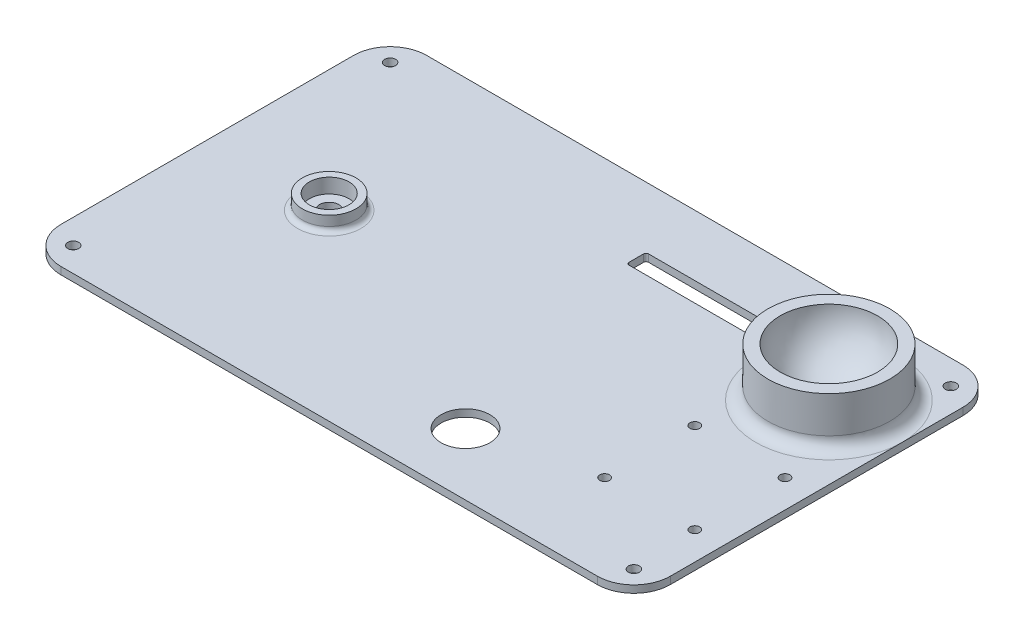
from build123d import *

# Parameters (mm, degrees)
CROQUIS1_W              = 250
CROQUIS1_H              = 150
SALIENTE_EXTRUIR1_DEPTH = 3
REDONDEO1_R             = 15
CORTAR_EXTRUIR1_REACH   = 147.805
CROQUIS2_R              = 2.25
CROQUIS3_R              = 4
CORTAR_EXTRUIR2_DEPTH   = 5
CROQUIS4_R              = 11
CROQUIS4_R_2            = 8.15
SALIENTE_EXTRUIR2_DEPTH = 6
REDONDEO2_R             = 2
CROQUIS5_R              = 25
CROQUIS5_R_2            = 20
SALIENTE_EXTRUIR3_DEPTH = 20
REDONDEO3_R             = 20
REDONDEO4_R             = 5
CROQUIS11_W             = 60
CROQUIS11_H             = 8
CORTAR_EXTRUIR6_DEPTH   = 20
REDONDEO7_R             = 1
CROQUIS12_R             = 10
CORTAR_EXTRUIR7_DEPTH   = 200
CROQUIS6_R              = 2
CORTAR_EXTRUIR8_DEPTH   = 10


with BuildPart() as part:
    # Croquis1 → Saliente-Extruir1 (new body)
    with BuildSketch(Plane(origin=(0, 0, 0), x_dir=(1, 0, 0), z_dir=(0, 1, 0))):
        Rectangle(CROQUIS1_W, CROQUIS1_H)
    extrude(amount=SALIENTE_EXTRUIR1_DEPTH)

    # Redondeo1
    redondeo1_edges = [part.edges().sort_by_distance(p)[0] for p in [
        (125, 1.5, 75),
        (-125, 1.5, 75),
        (-125, 1.5, -75),
        (125, 1.5, -75),
    ]]
    fillet(redondeo1_edges, radius=REDONDEO1_R)

    # Croquis2 → Cortar-Extruir1 (cut, up to next)
    with BuildSketch(Plane(origin=(0, 3, 0), x_dir=(1, 0, 0), z_dir=(0, 1, 0)), mode=Mode.PRIVATE) as cortar_extruir1_sk1:
        with Locations(Location((-115, 65, 0), (0, 0, 270))):
            Circle(CROQUIS2_R)
    cortar_extruir1_tool1 = extrude(cortar_extruir1_sk1.sketch, amount=-CORTAR_EXTRUIR1_REACH, mode=Mode.PRIVATE) & part.part
    # Croquis2 → Cortar-Extruir1 (cut, up to next)
    with BuildSketch(Plane(origin=(0, 3, 0), x_dir=(1, 0, 0), z_dir=(0, 1, 0)), mode=Mode.PRIVATE) as cortar_extruir1_sk2:
        with Locations(Location((115, 65, 0), (0, 0, 270))):
            Circle(CROQUIS2_R)
    cortar_extruir1_tool2 = extrude(cortar_extruir1_sk2.sketch, amount=-CORTAR_EXTRUIR1_REACH, mode=Mode.PRIVATE) & part.part
    # Croquis2 → Cortar-Extruir1 (cut, up to next)
    with BuildSketch(Plane(origin=(0, 3, 0), x_dir=(1, 0, 0), z_dir=(0, 1, 0)), mode=Mode.PRIVATE) as cortar_extruir1_sk3:
        with Locations(Location((115, -65, 0), (0, 0, 270))):
            Circle(CROQUIS2_R)
    cortar_extruir1_tool3 = extrude(cortar_extruir1_sk3.sketch, amount=-CORTAR_EXTRUIR1_REACH, mode=Mode.PRIVATE) & part.part
    # Croquis2 → Cortar-Extruir1 (cut, up to next)
    with BuildSketch(Plane(origin=(0, 3, 0), x_dir=(1, 0, 0), z_dir=(0, 1, 0)), mode=Mode.PRIVATE) as cortar_extruir1_sk4:
        with Locations(Location((-115, -65, 0), (0, 0, 270))):
            Circle(CROQUIS2_R)
    cortar_extruir1_tool4 = extrude(cortar_extruir1_sk4.sketch, amount=-CORTAR_EXTRUIR1_REACH, mode=Mode.PRIVATE) & part.part
    add(cortar_extruir1_tool1.solids().sort_by_distance((-115, 3, -65))[0], mode=Mode.SUBTRACT)
    add(cortar_extruir1_tool2.solids().sort_by_distance((115, 3, -65))[0], mode=Mode.SUBTRACT)
    add(cortar_extruir1_tool3.solids().sort_by_distance((115, 3, 65))[0], mode=Mode.SUBTRACT)
    add(cortar_extruir1_tool4.solids().sort_by_distance((-115, 3, 65))[0], mode=Mode.SUBTRACT)

    # Croquis3 → Cortar-Extruir2 (cut)
    with BuildSketch(Plane(origin=(0, 3, 0), x_dir=(1, 0, 0), z_dir=(0, 1, 0))):
        with Locations(Location((-75, 0, 0), (0, 0, 270))):
            Circle(CROQUIS3_R)
    extrude(amount=-CORTAR_EXTRUIR2_DEPTH, mode=Mode.SUBTRACT)

    # Croquis4 → Saliente-Extruir2 (add)
    with BuildSketch(Plane(origin=(0, 3, 0), x_dir=(1, 0, 0), z_dir=(0, 1, 0))):
        with Locations(Location((-75, 0, 0), (0, 0, 90))):
            Circle(CROQUIS4_R)
        with Locations(Location((-75, 0, 0), (0, 0, 270))):
            Circle(CROQUIS4_R_2, mode=Mode.SUBTRACT)
    extrude(amount=SALIENTE_EXTRUIR2_DEPTH)

    # Redondeo2
    redondeo2_edges = [part.edges().sort_by_distance(p)[0] for p in [
        (-75, 3, 11),
    ]]
    fillet(redondeo2_edges, radius=REDONDEO2_R)

    # Croquis5 → Saliente-Extruir3 (add)
    with BuildSketch(Plane(origin=(0, 3, 0), x_dir=(1, 0, 0), z_dir=(0, 1, 0))):
        with Locations(Location((95, 35, 0), (0, 0, 90))):
            Circle(CROQUIS5_R)
        with Locations(Location((95, 35, 0), (0, 0, 270))):
            Circle(CROQUIS5_R_2, mode=Mode.SUBTRACT)
    extrude(amount=SALIENTE_EXTRUIR3_DEPTH)

    # Redondeo3
    redondeo3_edges = [part.edges().sort_by_distance(p)[0] for p in [
        (95, 3, -55),
    ]]
    fillet(redondeo3_edges, radius=REDONDEO3_R - 0.0001)  # a hair under: the kernel refuses the full size

    # Redondeo4
    redondeo4_edges = [part.edges().sort_by_distance(p)[0] for p in [
        (95, 3, -10),
    ]]
    fillet(redondeo4_edges, radius=REDONDEO4_R - 0.0001)  # a hair under: the kernel refuses the full size

    # Croquis11 → Cortar-Extruir6 (cut)
    with BuildSketch(Plane(origin=(0, 3, 0), x_dir=(1, 0, 0), z_dir=(0, 1, 0))):
        with Locations((35, 46)):
            Rectangle(CROQUIS11_W, CROQUIS11_H)
    extrude(amount=-CORTAR_EXTRUIR6_DEPTH, mode=Mode.SUBTRACT)

    # Redondeo7
    redondeo7_edges = [part.edges().sort_by_distance(p)[0] for p in [
        (5, 1.5, -42),
        (5, 1.5, -50),
        (65, 1.5, -50),
        (65, 1.5, -42),
    ]]
    fillet(redondeo7_edges, radius=REDONDEO7_R)

    # Croquis12 → Cortar-Extruir7 (cut)
    with BuildSketch(Plane(origin=(0, 3, 0), x_dir=(1, 0, 0), z_dir=(0, 1, 0))):
        with Locations(Location((30.572379794, -49.649260846, 0), (0, 0, 270))):
            Circle(CROQUIS12_R)
    extrude(amount=-CORTAR_EXTRUIR7_DEPTH, mode=Mode.SUBTRACT)

    # Croquis6 → Cortar-Extruir8 (cut)
    with BuildSketch(Plane(origin=(0, 3, 0), x_dir=(1, 0, 0), z_dir=(0, 1, 0))):
        with Locations(Location((113.5, -1.5, 0), (0, 0, 270))):
            Circle(CROQUIS6_R)
        with Locations(Location((113.5, -38.5, 0), (0, 0, 270))):
            Circle(CROQUIS6_R)
        with Locations(Location((76.5, -38.5, 0), (0, 0, 270))):
            Circle(CROQUIS6_R)
        with Locations(Location((76.5, -1.5, 0), (0, 0, 270))):
            Circle(CROQUIS6_R)
    extrude(amount=-CORTAR_EXTRUIR8_DEPTH, mode=Mode.SUBTRACT)


solid = part.part
